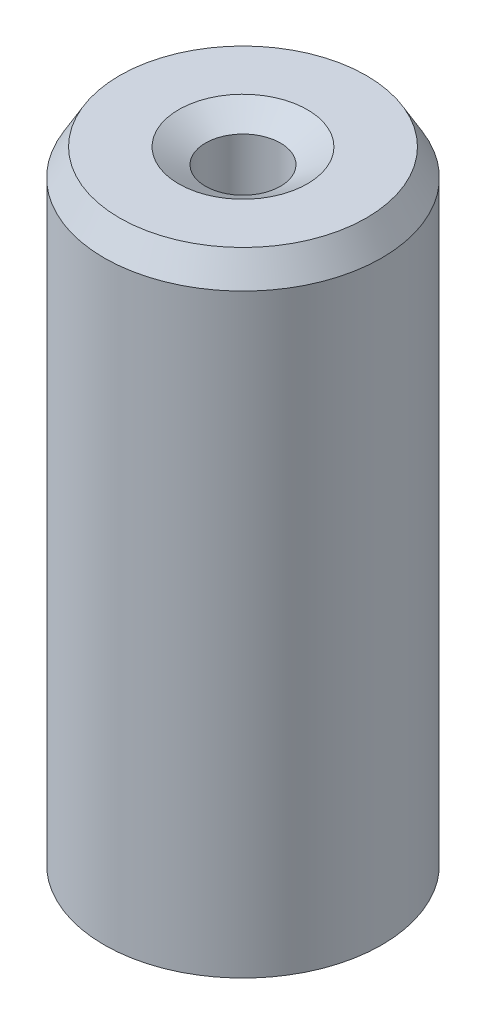
from build123d import *
from OCP.BRepFilletAPI import BRepFilletAPI_MakeChamfer

# Parameters (mm, degrees)
SKETCH1_R           = 5
BOSS_EXTRUDE1_DEPTH = 22.942483195
SKETCH2_R           = 1.349930515
CUT_EXTRUDE1_DEPTH  = 25.007447493
CHAMFER1_SIZE       = 0.96608947
CHAMFER1_SIZE2      = 0.557772016


with BuildPart() as part:
    # Sketch1 → Boss-Extrude1 (new body)
    with BuildSketch(Plane(origin=(0, 0, 0), x_dir=(1, 0, 0), z_dir=(0, 1, 0))):
        Circle(SKETCH1_R)
    extrude(amount=BOSS_EXTRUDE1_DEPTH)

    # Sketch2 → Cut-Extrude1 (cut, through all)
    with BuildSketch(Plane(origin=(0, 0, 0), x_dir=(1, 0, 0), z_dir=(0, 1, 0))):
        Circle(SKETCH2_R)
    extrude(amount=CUT_EXTRUDE1_DEPTH, mode=Mode.SUBTRACT)

    # Chamfer1: one chamfer whose edges measure the first distance from different faces: ONE call of the kernel's chamfer builder (chamfer() names one face for all edges)
    chamfer1_edges_1 = [part.edges().sort_by_distance(p)[0] for p in [
        (-1.349930515, 22.942483195, 0),
    ]]
    chamfer1_side_1 = [part.faces().sort_by_distance(p)[0] for p in [
        (-4.858578644, 22.942483195, 0),
    ]]
    chamfer1_edges_2 = [part.edges().sort_by_distance(p)[0] for p in [
        (-1.349930515, 0, 0),
    ]]
    chamfer1_side_2 = [part.faces().sort_by_distance(p)[0] for p in [
        (-1.349930515, 11.471241597, 0),
    ]]
    chamfer1_edges_3 = [part.edges().sort_by_distance(p)[0] for p in [
        (-5, 0, 0),
    ]]
    chamfer1_side_3 = [part.faces().sort_by_distance(p)[0] for p in [
        (-4.858578644, 0, 0),
    ]]
    chamfer1_edges_4 = [part.edges().sort_by_distance(p)[0] for p in [
        (-5, 22.942483195, 0),
    ]]
    chamfer1_side_4 = [part.faces().sort_by_distance(p)[0] for p in [
        (-5, 11.471241597, 0),
    ]]
    chamfer1 = BRepFilletAPI_MakeChamfer(part.part.solid().wrapped)
    for e in chamfer1_edges_1:
        chamfer1.Add(CHAMFER1_SIZE, CHAMFER1_SIZE2, e.wrapped, chamfer1_side_1[0].wrapped)  # the first distance lies on this face
    for e in chamfer1_edges_2:
        chamfer1.Add(CHAMFER1_SIZE, CHAMFER1_SIZE2, e.wrapped, chamfer1_side_2[0].wrapped)  # the first distance lies on this face
    for e in chamfer1_edges_3:
        chamfer1.Add(CHAMFER1_SIZE, CHAMFER1_SIZE2, e.wrapped, chamfer1_side_3[0].wrapped)  # the first distance lies on this face
    for e in chamfer1_edges_4:
        chamfer1.Add(CHAMFER1_SIZE, CHAMFER1_SIZE2, e.wrapped, chamfer1_side_4[0].wrapped)  # the first distance lies on this face
    add(Compound.cast(chamfer1.Shape()), mode=Mode.REPLACE)


solid = part.part
